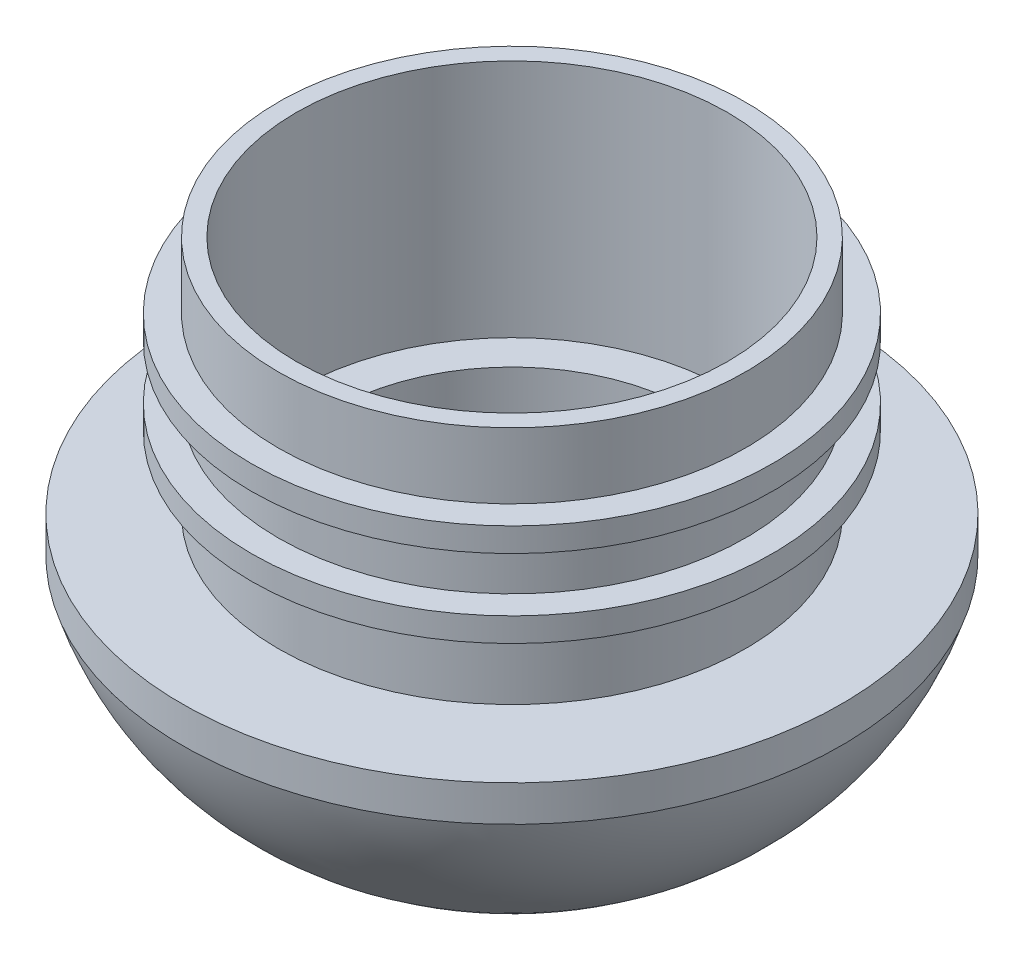
from build123d import *

# Parameters (mm, degrees)
SKETCH_1_R          = 19.5
SKETCH_1_R_2        = 18
EXTRUDE_1_DEPTH     = 20
SKETCH_3_R          = 27.5
EXTRUDE_2_DEPTH     = 3
SKETCH_4_R          = 21.75
EXTRUDE_3_DEPTH     = 2
EXTRUDE_START       = 3
SKETCH_8_R          = 21.75
EXTRUDE_4_DEPTH     = 2
SKETCH_6_R          = 18
CUT_EXTRUDE_1_DEPTH = 35
SKETCH_11_R         = 15
CUT_EXTRUDE_4_DEPTH = 18
SKETCH_20_R         = 15
SKETCH_20_R_2       = 14
EXTRUDE_7_DEPTH     = 2


with BuildPart() as part:
    # 草圖1 → 填料-伸長1 (new body)
    with BuildSketch(Plane(origin=(0, 0, 0), x_dir=(1, 0, 0), z_dir=(0, 1, 0))):
        Circle(SKETCH_1_R)
        Circle(SKETCH_1_R_2, mode=Mode.SUBTRACT)
    extrude(amount=EXTRUDE_1_DEPTH)

    # 草圖3 → 填料-伸長2 (add)
    with BuildSketch(Plane.XZ):
        Circle(SKETCH_3_R)
    extrude(amount=EXTRUDE_2_DEPTH)

    # 草圖4 → 填料-伸長3 (add)
    with BuildSketch(Plane(origin=(0, 8, 0), x_dir=(1, 0, 0), z_dir=(0, 1, 0))):
        Circle(SKETCH_4_R)
    extrude(amount=-EXTRUDE_3_DEPTH)

    # 草圖8 → 填料-伸長4 (add)
    with BuildSketch(Plane(origin=(0, 11.5, 0), x_dir=(1, 0, 0), z_dir=(0, 1, 0)).offset(EXTRUDE_START)):
        Circle(SKETCH_8_R)
    extrude(amount=-EXTRUDE_4_DEPTH)

    # 草圖6 → 除料-伸長1 (cut)
    with BuildSketch(Plane(origin=(0, 0, 0), x_dir=(1, 0, 0), z_dir=(0, 1, 0))):
        Circle(SKETCH_6_R)
    extrude(amount=CUT_EXTRUDE_1_DEPTH, mode=Mode.SUBTRACT)

    # 草圖18 → 旋轉3 (revolve)
    with BuildSketch(Plane(origin=(0, 0, 0), x_dir=(0, 0, -1), z_dir=(1, 0, 0))):
        with BuildLine():
            Line((15, -3), (15, -18))
            ThreePointArc((15, -18), (22.774964719, -11.770803933), (27.5, -3))
            Line((27.5, -3), (15, -3))
        make_face()
    revolve(axis=Axis((0, -18, 0), (0, 1, 0)))

    # 草圖11 → 除料-伸長4 (cut)
    with BuildSketch(Plane(origin=(0, -18, 0), x_dir=(-1, 0, 0), z_dir=(0, -1, 0))):
        Circle(SKETCH_11_R)
    extrude(amount=-CUT_EXTRUDE_4_DEPTH, mode=Mode.SUBTRACT)

    # 草圖20 → 填料-伸長7 (add)
    with BuildSketch(Plane(origin=(0, -16, 0), x_dir=(-1, 0, 0), z_dir=(0, -1, 0))):
        Circle(SKETCH_20_R)
        Circle(SKETCH_20_R_2, mode=Mode.SUBTRACT)
    extrude(amount=-EXTRUDE_7_DEPTH)


solid = part.part
